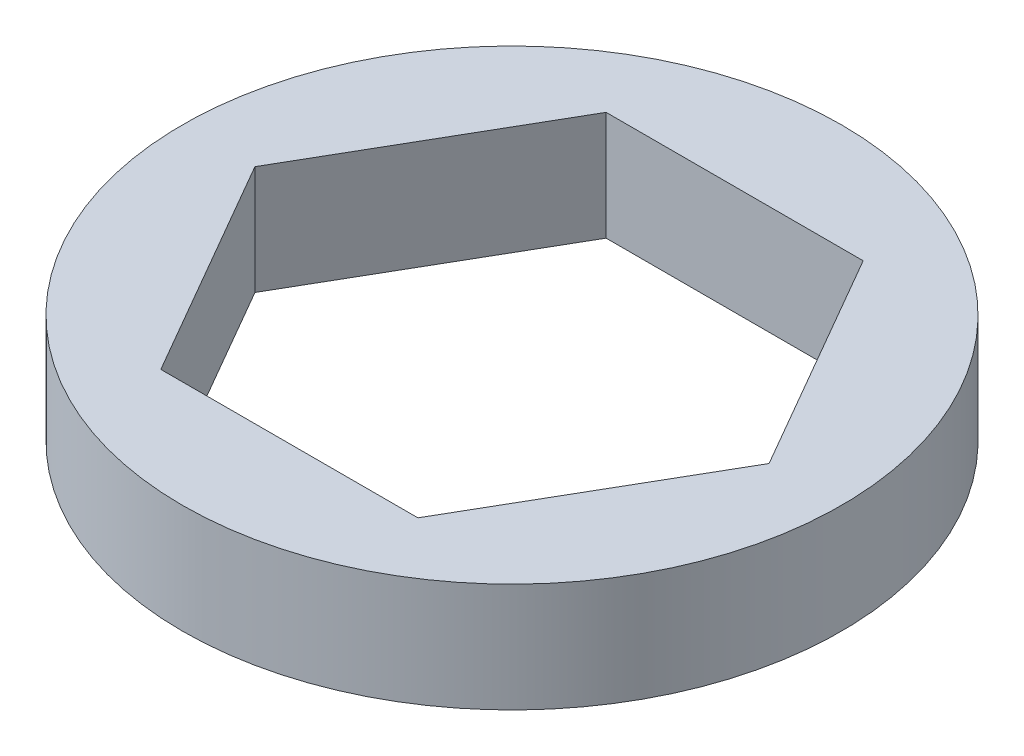
from build123d import *

# Parameters (mm, degrees)
SKETCH1_R           = 7.14375
BOSS_EXTRUDE1_DEPTH = 1.1811


with BuildPart() as part:
    # Sketch1 → Boss-Extrude1 (new, symmetric)
    with BuildSketch(Plane(origin=(0, 0, 0), x_dir=(1, 0, 0), z_dir=(0, 1, 0))):
        Circle(SKETCH1_R)
        Polygon((2.786292399, -4.826), (5.572584798, 0), (2.786292399, 4.826), (-2.786292399, 4.826), (-5.572584798, 0), (-2.786292399, -4.826), align=None, mode=Mode.SUBTRACT)
    extrude(amount=BOSS_EXTRUDE1_DEPTH, both=True)


solid = part.part
